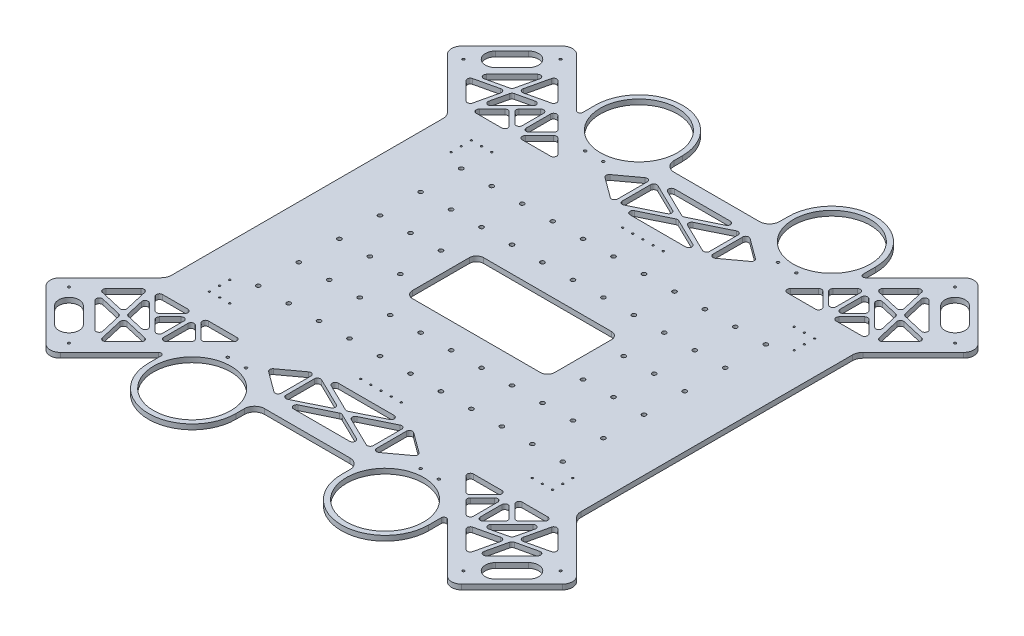
from build123d import *

# Parameters (mm, degrees)
BOSS_EXTRUDE1_DEPTH     = 6.35
CUT_EXTRUDE1_REACH      = 540.853
SKETCH3_R               = 48.260000044
F_4_CLEARANCE_HOLE2_D   = 2.9464
MIRROR2_COPY_1_REACH    = 540.853
MIRROR2_COPY_1_SKETCH_R = 48.260000044
MIRROR2_COPY_2_D        = 2.9464
F_4_CLEARANCE_HOLE1_D   = 3.2639
CUT_EXTRUDE10_DEPTH     = 468.199873044
MIRROR4_COPY_1_D        = 3.2639
MIRROR4_COPY_2_DEPTH    = 468.199873044
F_4_40_TAPPED_HOLE1_D   = 2.2606
CUT_EXTRUDE3_REACH      = 469.2
SKETCH5_W               = 177.8
SKETCH5_H               = 88.9
FILLET1_R               = 8.89
FILLET5_R               = 3.175
FILLET6_R               = 12.7
CUT_EXTRUDE11_DEPTH     = 468.199873044
BOSS_EXTRUDE2_DEPTH     = 6.35
FILLET7_R               = 3.81
FILLET7_OF_MIRROR5_R    = 3.81
MIRROR6_START           = -6.35
MIRROR6_DEPTH           = 6.35
F_1_4_20_TAPPED_HOLE2_D = 5.1054
LPATTERN10_COUNT        = 6
LPATTERN10_PITCH        = 50.8
LPATTERN10_COUNT_DIR2   = 11
LPATTERN10_PITCH_DIR2   = 38.1


# Read off the part's stored shape, not the designer's step: Mirror6
with BuildPart() as part:
    # Sketch1 → Boss-Extrude1 (new body)
    with BuildSketch(Plane(origin=(0, 0, 0), x_dir=(1, 0, 0), z_dir=(0, 1, 0))):
        Polygon((254, -381), (-254, -381), (-381, -254), (-381, 254), (-254, 381), (254, 381), (381, 254), (381, -254), align=None)
    extrude(amount=-BOSS_EXTRUDE1_DEPTH)

    # Sketch3 → Cut-Extrude1 (cut, up to next)
    with BuildSketch(Plane(origin=(0, 0, 0), x_dir=(1, 0, 0), z_dir=(0, 1, 0)), mode=Mode.PRIVATE) as cut_extrude1_sk1:
        with BuildLine():
            Line((-175.260000044, -256.082305134), (-242.065848583, -322.888153673))
            ThreePointArc((-242.065848583, -322.888153673), (-251.046104704, -326.607897552), (-260.026360825, -322.888153673))
            Line((-260.026360825, -322.888153673), (-322.888153673, -260.026360825))
            ThreePointArc((-322.888153673, -260.026360825), (-326.607897552, -251.046104704), (-322.888153673, -242.065848583))
            Line((-322.888153673, -242.065848583), (-256.082305134, -175.260000044))
            Line((-256.082305134, -175.260000044), (-256.082305134, 0))
            Line((-256.082305134, 0), (-381, 0))
            Line((-381, 0), (-381, -254))
            Line((-381, -254), (-254, -381))
            Line((-254, -381), (0, -381))
            Line((0, -381), (0, -256.082305134))
            Line((0, -256.082305134), (-66.039999956, -256.082305134))
            Line((-66.039999956, -256.082305134), (-66.039999956, -279.4))
            ThreePointArc((-66.039999956, -279.4), (-120.65, -334.010000044), (-175.260000044, -279.4))
            Line((-175.260000044, -279.4), (-175.260000044, -256.082305134))
        make_face()
    cut_extrude1_tool1 = extrude(cut_extrude1_sk1.sketch, amount=-CUT_EXTRUDE1_REACH, mode=Mode.PRIVATE) & part.part
    # Sketch3 → Cut-Extrude1 (cut, up to next)
    with BuildSketch(Plane(origin=(0, 0, 0), x_dir=(1, 0, 0), z_dir=(0, 1, 0)), mode=Mode.PRIVATE) as cut_extrude1_sk2:
        with Locations(Location((-120.65, -279.4, 0), (0, 0, 270))):
            Circle(SKETCH3_R)
    cut_extrude1_tool2 = extrude(cut_extrude1_sk2.sketch, amount=-CUT_EXTRUDE1_REACH, mode=Mode.PRIVATE) & part.part
    cut_extrude1_1 = cut_extrude1_tool1.solids().sort_by_distance((-180.648154, 0, 267.741153))[0]
    add(cut_extrude1_1, mode=Mode.SUBTRACT)
    cut_extrude1_2 = cut_extrude1_tool2.solids().sort_by_distance((-120.65, 0, 279.4))[0]
    add(cut_extrude1_2, mode=Mode.SUBTRACT)
    cut_extrude1 = cut_extrude1_1 + cut_extrude1_2  # Cut-Extrude1 as one shape, for the pattern or mirror that repeats it

    # #4 Clearance Hole2 (through all)
    with Locations(Plane(origin=(0, 0, 0), x_dir=(1, 0, 0), z_dir=(0, 1, 0))):
        with Locations((-307.481994282, -246.695700628), (-246.695700628, -307.481994282)):
            f_4_clearance_hole2 = Hole(F_4_CLEARANCE_HOLE2_D / 2)

    # Mirror1: Cut-Extrude1, #4 Clearance Hole2 across plane
    add(cut_extrude1.mirror(Plane(origin=(0, 0, 0), x_dir=(0, 0, 1), z_dir=(1, 0, 0))), mode=Mode.SUBTRACT)
    add(f_4_clearance_hole2.mirror(Plane(origin=(0, 0, 0), x_dir=(0, 0, 1), z_dir=(1, 0, 0))), mode=Mode.SUBTRACT)

    # Mirror2: Cut-Extrude1, #4 Clearance Hole2 across plane
    add(cut_extrude1.mirror(Plane.XY), mode=Mode.SUBTRACT)
    add(f_4_clearance_hole2.mirror(Plane.XY), mode=Mode.SUBTRACT)

    # Mirror2 copy 1 sketch → Mirror2 copy 1 (cut, up to next)
    with BuildSketch(Plane(origin=(0, 0, 0), x_dir=(-1, 0, 0), z_dir=(0, 1, 0)), mode=Mode.PRIVATE) as mirror2_copy_1_sk1:
        with BuildLine():
            Line((-175.260000044, -256.082305134), (-242.065848583, -322.888153673))
            ThreePointArc((-242.065848583, -322.888153673), (-251.046104704, -326.607897552), (-260.026360825, -322.888153673))
            Line((-260.026360825, -322.888153673), (-322.888153673, -260.026360825))
            ThreePointArc((-322.888153673, -260.026360825), (-326.607897552, -251.046104704), (-322.888153673, -242.065848583))
            Line((-322.888153673, -242.065848583), (-256.082305134, -175.260000044))
            Line((-256.082305134, -175.260000044), (-256.082305134, 0))
            Line((-256.082305134, 0), (-381, 0))
            Line((-381, 0), (-381, -254))
            Line((-381, -254), (-254, -381))
            Line((-254, -381), (0, -381))
            Line((0, -381), (0, -256.082305134))
            Line((0, -256.082305134), (-66.039999956, -256.082305134))
            Line((-66.039999956, -256.082305134), (-66.039999956, -279.4))
            ThreePointArc((-66.039999956, -279.4), (-120.65, -334.010000044), (-175.260000044, -279.4))
            Line((-175.260000044, -279.4), (-175.260000044, -256.082305134))
        make_face()
    mirror2_copy_1_tool1 = extrude(mirror2_copy_1_sk1.sketch, amount=-MIRROR2_COPY_1_REACH, mode=Mode.PRIVATE) & part.part
    # Mirror2 copy 1 sketch → Mirror2 copy 1 (cut, up to next)
    with BuildSketch(Plane(origin=(0, 0, 0), x_dir=(-1, 0, 0), z_dir=(0, 1, 0)), mode=Mode.PRIVATE) as mirror2_copy_1_sk2:
        with Locations(Location((-120.65, -279.4, 0), (0, 0, 270))):
            Circle(MIRROR2_COPY_1_SKETCH_R)
    mirror2_copy_1_tool2 = extrude(mirror2_copy_1_sk2.sketch, amount=-MIRROR2_COPY_1_REACH, mode=Mode.PRIVATE) & part.part
    add(mirror2_copy_1_tool1.solids().sort_by_distance((180.648154, 0, -267.741153))[0], mode=Mode.SUBTRACT)
    add(mirror2_copy_1_tool2.solids().sort_by_distance((120.65, 0, -279.4))[0], mode=Mode.SUBTRACT)

    # Mirror2 copy 2 (through all)
    with Locations(Plane(origin=(0, 0, 0), x_dir=(-1, 0, 0), z_dir=(0, 1, 0))):
        with Locations((-307.481994282, -246.695700628), (-246.695700628, -307.481994282)):
            Hole(MIRROR2_COPY_2_D / 2)

    # #4 Clearance Hole1 (through all)
    with Locations(Plane(origin=(0, 0, 0), x_dir=(1, 0, 0), z_dir=(0, 1, 0))):
        with Locations((109.22, -223.520030004), (132.08, -223.520030004)):
            f_4_clearance_hole1 = Hole(F_4_CLEARANCE_HOLE1_D / 2)

    # Sketch13 → Cut-Extrude10 (cut, through all)
    with BuildSketch(Plane.XZ.offset(6.35)):
        with BuildLine():
            Line((-278.377893355, -257.839289313), (-257.839289313, -278.377893355))
            ThreePointArc((-257.839289313, -278.377893355), (-257.839289313, -296.338405597), (-275.799801555, -296.338405597))
            Line((-275.799801555, -296.338405597), (-296.338405597, -275.799801555))
            ThreePointArc((-296.338405597, -275.799801555), (-296.338405597, -257.839289313), (-278.377893355, -257.839289313))
        make_face()
    cut_extrude10 = extrude(amount=-CUT_EXTRUDE10_DEPTH, mode=Mode.SUBTRACT)

    # Mirror3: #4 Clearance Hole1, Cut-Extrude10 across plane
    add(f_4_clearance_hole1.mirror(Plane(origin=(0, 0, 0), x_dir=(0, 0, 1), z_dir=(1, 0, 0))), mode=Mode.SUBTRACT)
    add(cut_extrude10.mirror(Plane(origin=(0, 0, 0), x_dir=(0, 0, 1), z_dir=(1, 0, 0))), mode=Mode.SUBTRACT)

    # Mirror4: #4 Clearance Hole1, Cut-Extrude10 across plane
    add(f_4_clearance_hole1.mirror(Plane.XY), mode=Mode.SUBTRACT)
    add(cut_extrude10.mirror(Plane.XY), mode=Mode.SUBTRACT)

    # Mirror4 copy 1 (through all)
    with Locations(Plane(origin=(0, 0, 0), x_dir=(-1, 0, 0), z_dir=(0, 1, 0))):
        with Locations((109.22, -223.520030004), (132.08, -223.520030004)):
            Hole(MIRROR4_COPY_1_D / 2)

    # Mirror4 copy 2 sketch → Mirror4 copy 2 (cut, through all)
    with BuildSketch(Plane(origin=(0, -6.35, 0), x_dir=(-1, 0, 0), z_dir=(0, -1, 0))):
        with BuildLine():
            Line((-278.377893355, -257.839289313), (-257.839289313, -278.377893355))
            ThreePointArc((-257.839289313, -278.377893355), (-257.839289313, -296.338405597), (-275.799801555, -296.338405597))
            Line((-275.799801555, -296.338405597), (-296.338405597, -275.799801555))
            ThreePointArc((-296.338405597, -275.799801555), (-296.338405597, -257.839289313), (-278.377893355, -257.839289313))
        make_face()
    extrude(amount=-MIRROR4_COPY_2_DEPTH, mode=Mode.SUBTRACT)

    # #4-40 Tapped Hole1 (through all)
    with Locations(Plane(origin=(0, -6.35, 0), x_dir=(-1, 0, 0), z_dir=(0, -1, 0))):
        with Locations((189.23, -163.83), (201.93, -163.83), (214.63, -163.83), (214.63, -151.13), (214.63, -138.43), (25.4, -163.83), (12.7, -163.83), (0, -163.83), (-12.7, -163.83), (-25.4, -163.83), (-189.23, -163.83), (-201.93, -163.83), (-214.63, -163.83), (-214.63, -151.13), (-214.63, -138.43), (214.63, 138.43), (214.63, 151.13), (214.63, 163.83), (201.93, 163.83), (189.23, 163.83), (25.4, 163.83), (12.7, 163.83), (0, 163.83), (-12.7, 163.83), (-25.4, 163.83), (-214.63, 163.83), (-214.63, 151.13), (-214.63, 138.43), (-201.93, 163.83), (-189.23, 163.83)):
            Hole(F_4_40_TAPPED_HOLE1_D / 2)

    # Sketch5 → Cut-Extrude3 (cut, up to next)
    with BuildSketch(Plane(origin=(0, 0, 0), x_dir=(1, 0, 0), z_dir=(0, 1, 0)), mode=Mode.PRIVATE) as cut_extrude3_sk1:
        Rectangle(SKETCH5_W, SKETCH5_H)
    cut_extrude3_tool1 = extrude(cut_extrude3_sk1.sketch, amount=-CUT_EXTRUDE3_REACH, mode=Mode.PRIVATE) & part.part
    add(cut_extrude3_tool1.solids().sort_by_distance((0, 0, 0))[0], mode=Mode.SUBTRACT)

    # Fillet1
    fillet1_edges = [part.edges().sort_by_distance(p)[0] for p in [
        (88.9, -3.175, -44.45),
        (88.9, -3.175, 44.45),
        (-88.9, -3.175, 44.45),
        (-88.9, -3.175, -44.45),
    ]]
    fillet(fillet1_edges, radius=FILLET1_R)

    # Fillet5
    fillet5_edges = [part.edges().sort_by_distance(p)[0] for p in [
        (175.260000044, -3.175, -256.082305134),
        (-175.260000044, -3.175, -256.082305134),
        (-175.260000044, -3.175, 256.082305134),
        (175.260000044, -3.175, 256.082305134),
    ]]
    fillet(fillet5_edges, radius=FILLET5_R)

    # Fillet6
    fillet6_edges = [part.edges().sort_by_distance(p)[0] for p in [
        (66.039999956, -3.175, 256.082305134),
        (66.039999956, -3.175, -256.082305134),
        (256.082305134, -3.175, -175.260000044),
        (-256.082305134, -3.175, -175.260000044),
        (-66.039999956, -3.175, -256.082305134),
        (-66.039999956, -3.175, 256.082305134),
        (-256.082305134, -3.175, 175.260000044),
        (256.082305134, -3.175, 175.260000044),
    ]]
    fillet(fillet6_edges, radius=FILLET6_R)

    # Sketch22 → Cut-Extrude11 (cut, through all)
    with BuildSketch(Plane.XZ.offset(6.35)):
        Polygon((-57.15, 182.422305134), (57.15, 182.422305134), (95.25, 210.362305134), (57.15, 238.302305134), (-57.15, 238.302305134), (-95.25, 210.362305134), align=None)
        Polygon((196.266542366, 253.74018154), (232.18756685, 289.661206025), (289.661206025, 232.18756685), (253.74018154, 196.266542366), (196.266542366, 196.266542366), (138.792903191, 196.266542366), align=None)
    cut_extrude11 = extrude(amount=-CUT_EXTRUDE11_DEPTH, mode=Mode.SUBTRACT)

    # Sketch23 → Boss-Extrude2 (add)
    # profile 1 of 2: a face of its own
    with BuildSketch(Plane.XZ.offset(6.35)):
        Polygon((-59.69, 242.37138057), (-59.69, 178.353229697), (0, 207.535007475), (59.69, 178.353229697), (59.69, 242.37138057), (0, 213.189602792), align=None)
        Polygon((-54.61, 186.49138057), (-5.783108847, 210.362305134), (-54.61, 234.233229697), align=None, mode=Mode.SUBTRACT)
        Polygon((54.61, 186.49138057), (5.783108847, 210.362305134), (54.61, 234.233229697), align=None, mode=Mode.SUBTRACT)
    # profile 2 of 2: a face of its own
    with BuildSketch(Plane.XZ.offset(6.35)):
        Polygon((196.266542366, 192.674439917), (225.003361953, 221.411259505), (258.206594947, 188.20802651), (246.352656867, 239.575091523), (289.090062878, 229.712613213), (290.232349172, 234.662520487), (245.081863365, 245.081863365), (234.662520487, 290.232349172), (229.712613213, 289.090062878), (239.575091523, 246.352656867), (188.20802651, 258.206594947), (193.726542366, 252.688079092), (193.726542366, 202.398644814), (169.325774002, 226.799413177), (165.733671554, 223.207310729), align=None)
        Polygon((249.273768134, 204.325058221), (204.325058221, 249.273768134), (240.845885025, 240.845885025), align=None, mode=Mode.SUBTRACT)
        Polygon((221.411259505, 225.003361953), (198.806542366, 247.608079092), (198.806542366, 202.398644814), align=None, mode=Mode.SUBTRACT)
    boss_extrude2 = extrude(amount=-BOSS_EXTRUDE2_DEPTH)

    # Fillet7
    fillet7_edges = [part.edges().sort_by_distance(p)[0] for p in [
        (95.25, -3.175, 210.362305134),
        (-95.25, -3.175, 210.362305134),
        (138.792903191, -3.175, 196.266542366),
        (51.366891153, -3.175, 238.302305134),
        (-51.366891153, -3.175, 238.302305134),
        (-59.69, -3.175, 236.439638467),
        (-51.366891153, -3.175, 182.422305134),
        (51.366891153, -3.175, 182.422305134),
        (59.69, -3.175, 184.2849718),
        (59.69, -3.175, 236.439638467),
        (0, -3.175, 207.535007475),
        (-59.69, -3.175, 184.2849718),
        (0, -3.175, 213.189602792),
        (54.61, -3.175, 186.49138057),
        (5.783108847, -3.175, 210.362305134),
        (54.61, -3.175, 234.233229697),
        (-5.783108847, -3.175, 210.362305134),
        (-54.61, -3.175, 186.49138057),
        (-54.61, -3.175, 234.233229697),
        (192.674439917, -3.175, 196.266542366),
        (199.858644814, -3.175, 196.266542366),
        (250.148079092, -3.175, 196.266542366),
        (255.858170711, -3.175, 198.384531536),
        (287.543216855, -3.175, 230.06957768),
        (286.272423352, -3.175, 235.576349522),
        (235.576349522, -3.175, 286.272423352),
        (230.06957768, -3.175, 287.543216855),
        (198.384531536, -3.175, 255.858170711),
        (193.726542366, -3.175, 251.20018154),
        (193.726542366, -3.175, 202.398644814),
        (239.575091523, -3.175, 246.352656867),
        (245.081863365, -3.175, 245.081863365),
        (246.352656867, -3.175, 239.575091523),
        (225.003361953, -3.175, 221.411259505),
        (165.733671554, -3.175, 223.207310729),
        (169.325774002, -3.175, 226.799413177),
        (249.273768134, -3.175, 204.325058221),
        (204.325058221, -3.175, 249.273768134),
        (240.845885025, -3.175, 240.845885025),
        (198.806542366, -3.175, 202.398644814),
        (198.806542366, -3.175, 247.608079092),
        (221.411259505, -3.175, 225.003361953),
    ]]
    fillet(fillet7_edges, radius=FILLET7_R)

    # Mirror5: Cut-Extrude11, Boss-Extrude2 across plane
    add(cut_extrude11.mirror(Plane(origin=(0, 0, 0), x_dir=(0, 0, 1), z_dir=(1, 0, 0))), mode=Mode.SUBTRACT)
    add(boss_extrude2.mirror(Plane(origin=(0, 0, 0), x_dir=(0, 0, 1), z_dir=(1, 0, 0))))

    # Fillet7 of Mirror5
    fillet7_of_mirror5_edges = [part.edges().sort_by_distance(p)[0] for p in [
        (-95.25, -3.175, 210.362305134),
        (95.25, -3.175, 210.362305134),
        (-138.792903191, -3.175, 196.266542366),
        (-51.366891153, -3.175, 238.302305134),
        (51.366891153, -3.175, 238.302305134),
        (59.69, -3.175, 236.439638467),
        (51.366891153, -3.175, 182.422305134),
        (-51.366891153, -3.175, 182.422305134),
        (-59.69, -3.175, 184.2849718),
        (-59.69, -3.175, 236.439638467),
        (0, -3.175, 207.535007475),
        (59.69, -3.175, 184.2849718),
        (0, -3.175, 213.189602792),
        (-54.61, -3.175, 186.49138057),
        (-5.783108847, -3.175, 210.362305134),
        (-54.61, -3.175, 234.233229697),
        (5.783108847, -3.175, 210.362305134),
        (54.61, -3.175, 186.49138057),
        (54.61, -3.175, 234.233229697),
        (-192.674439917, -3.175, 196.266542366),
        (-199.858644814, -3.175, 196.266542366),
        (-250.148079092, -3.175, 196.266542366),
        (-255.858170711, -3.175, 198.384531536),
        (-287.543216855, -3.175, 230.06957768),
        (-286.272423352, -3.175, 235.576349522),
        (-235.576349522, -3.175, 286.272423352),
        (-230.06957768, -3.175, 287.543216855),
        (-198.384531536, -3.175, 255.858170711),
        (-193.726542366, -3.175, 251.20018154),
        (-193.726542366, -3.175, 202.398644814),
        (-239.575091523, -3.175, 246.352656867),
        (-245.081863365, -3.175, 245.081863365),
        (-246.352656867, -3.175, 239.575091523),
        (-225.003361953, -3.175, 221.411259505),
        (-165.733671554, -3.175, 223.207310729),
        (-169.325774002, -3.175, 226.799413177),
        (-249.273768134, -3.175, 204.325058221),
        (-204.325058221, -3.175, 249.273768134),
        (-240.845885025, -3.175, 240.845885025),
        (-198.806542366, -3.175, 202.398644814),
        (-198.806542366, -3.175, 247.608079092),
        (-221.411259505, -3.175, 225.003361953),
    ]]
    fillet(fillet7_of_mirror5_edges, radius=FILLET7_OF_MIRROR5_R)

    # Mirror6 outline → Mirror6 (cut)
    with BuildSketch(Plane(origin=(0, 0, 0), x_dir=(1, 0, 0), z_dir=(0, 1, 0)).offset(MIRROR6_START)):
        with BuildLine():
            Line((209.056798487, 196.266542366), (240.949925419, 196.266542366))
            ThreePointArc((240.949925419, 196.266542366), (244.469906438, 198.618518488), (243.644002256, 202.770619202))
            Line((243.644002256, 202.770619202), (227.697438789, 218.717182668))
            ThreePointArc((227.697438789, 218.717182668), (225.003361953, 219.833105832), (222.309285117, 218.717182668))
            Line((222.309285117, 218.717182668), (206.36272165, 202.770619202))
            ThreePointArc((206.36272165, 202.770619202), (205.536817468, 198.618518488), (209.056798487, 196.266542366))
        make_face()
        with BuildLine():
            Line((147.991056863, 196.266542366), (183.476286244, 196.266542366))
            ThreePointArc((183.476286244, 196.266542366), (186.996267263, 198.618518488), (186.170363081, 202.770619202))
            Line((186.170363081, 202.770619202), (168.42774839, 220.513233892))
            ThreePointArc((168.42774839, 220.513233892), (165.733671554, 221.629157056), (163.039594718, 220.513233892))
            Line((163.039594718, 220.513233892), (145.296980027, 202.770619202))
            ThreePointArc((145.296980027, 202.770619202), (144.471075844, 198.618518488), (147.991056863, 196.266542366))
        make_face()
        with BuildLine():
            ThreePointArc((-243.644002256, 202.770619202), (-244.469906438, 198.618518488), (-240.949925419, 196.266542366))
            Line((-240.949925419, 196.266542366), (-209.056798487, 196.266542366))
            ThreePointArc((-209.056798487, 196.266542366), (-205.536817468, 198.618518488), (-206.36272165, 202.770619202))
            Line((-206.36272165, 202.770619202), (-222.309285117, 218.717182668))
            ThreePointArc((-222.309285117, 218.717182668), (-225.003361953, 219.833105832), (-227.697438789, 218.717182668))
            Line((-227.697438789, 218.717182668), (-243.644002256, 202.770619202))
        make_face()
        with BuildLine():
            ThreePointArc((-186.170363081, 202.770619202), (-186.996267263, 198.618518488), (-183.476286244, 196.266542366))
            Line((-183.476286244, 196.266542366), (-147.991056863, 196.266542366))
            ThreePointArc((-147.991056863, 196.266542366), (-144.471075844, 198.618518488), (-145.296980027, 202.770619202))
            Line((-145.296980027, 202.770619202), (-163.039594718, 220.513233892))
            ThreePointArc((-163.039594718, 220.513233892), (-165.733671554, 221.629157056), (-168.42774839, 220.513233892))
            Line((-168.42774839, 220.513233892), (-186.170363081, 202.770619202))
        make_face()
        with BuildLine():
            Line((260.718952489, 203.245313314), (282.682435077, 225.208795902))
            ThreePointArc((282.682435077, 225.208795902), (283.650715963, 228.953223113), (280.845072961, 231.615303194))
            Line((280.845072961, 231.615303194), (252.292545596, 238.20434797))
            ThreePointArc((252.292545596, 238.20434797), (248.741754039, 237.185994351), (247.72340042, 233.635202794))
            Line((247.72340042, 233.635202794), (254.312445197, 205.08267543))
            ThreePointArc((254.312445197, 205.08267543), (256.974525278, 202.277032427), (260.718952489, 203.245313314))
        make_face()
        with BuildLine():
            Line((276.878726406, 244.970046469), (244.970046469, 276.878726406))
            ThreePointArc((244.970046469, 276.878726406), (240.429001524, 277.517037423), (238.563539177, 273.327934849))
            Line((238.563539177, 273.327934849), (244.546416665, 247.4021324))
            ThreePointArc((244.546416665, 247.4021324), (245.564770284, 245.564770284), (247.4021324, 244.546416665))
            Line((247.4021324, 244.546416665), (273.327934849, 238.563539177))
            ThreePointArc((273.327934849, 238.563539177), (277.517037423, 240.429001524), (276.878726406, 244.970046469))
        make_face()
        with BuildLine():
            Line((187.222465529, 244.696104704), (172.019850839, 229.493490014))
            ThreePointArc((172.019850839, 229.493490014), (170.903927675, 226.799413178), (172.019850839, 224.105336341))
            Line((172.019850839, 224.105336341), (187.222465529, 208.90272165))
            ThreePointArc((187.222465529, 208.90272165), (191.374566243, 208.076817468), (193.726542366, 211.596798487))
            Line((193.726542366, 211.596798487), (193.726542366, 242.002027868))
            ThreePointArc((193.726542366, 242.002027868), (191.374566243, 245.522008887), (187.222465529, 244.696104704))
        make_face()
        with BuildLine():
            Line((225.208795902, 282.682435077), (203.245313314, 260.718952489))
            ThreePointArc((203.245313314, 260.718952489), (202.277032427, 256.974525278), (205.08267543, 254.312445197))
            Line((205.08267543, 254.312445197), (233.635202794, 247.72340042))
            ThreePointArc((233.635202794, 247.72340042), (237.185994351, 248.741754039), (238.20434797, 252.292545596))
            Line((238.20434797, 252.292545596), (231.615303194, 280.845072961))
            ThreePointArc((231.615303194, 280.845072961), (228.953223113, 283.650715963), (225.208795902, 282.682435077))
        make_face()
        with BuildLine():
            ThreePointArc((-59.69, 228.920965357), (-61.777820288, 232.319523439), (-65.753095558, 231.993368391))
            Line((-65.753095558, 231.993368391), (-91.060359499, 213.434708168))
            ThreePointArc((-91.060359499, 213.434708168), (-92.61726394, 210.362305134), (-91.060359499, 207.289902099))
            Line((-91.060359499, 207.289902099), (-65.753095558, 188.731241876))
            ThreePointArc((-65.753095558, 188.731241876), (-61.777820287, 188.405086828), (-59.69, 191.803644911))
            Line((-59.69, 191.803644911), (-59.69, 228.920965357))
        make_face()
        with BuildLine():
            ThreePointArc((-36.572436668, 189.655149549), (-38.6109955, 185.373508657), (-34.899046065, 182.422305134))
            Line((-34.899046065, 182.422305134), (34.899046065, 182.422305134))
            ThreePointArc((34.899046065, 182.422305134), (38.6109955, 185.373508657), (36.572436668, 189.655149549))
            Line((36.572436668, 189.655149549), (1.673390603, 206.716905403))
            ThreePointArc((1.673390603, 206.716905403), (0, 207.104060988), (-1.673390603, 206.716905403))
            Line((-1.673390603, 206.716905403), (-36.572436668, 189.655149549))
        make_face()
        with BuildLine():
            ThreePointArc((59.69, 191.803644911), (61.777820287, 188.405086828), (65.753095558, 188.731241876))
            Line((65.753095558, 188.731241876), (91.060359499, 207.289902099))
            ThreePointArc((91.060359499, 207.289902099), (92.61726394, 210.362305134), (91.060359499, 213.434708168))
            Line((91.060359499, 213.434708168), (65.753095558, 231.993368391))
            ThreePointArc((65.753095558, 231.993368391), (61.777820288, 232.319523439), (59.69, 228.920965357))
            Line((59.69, 228.920965357), (59.69, 191.803644911))
        make_face()
        with BuildLine():
            ThreePointArc((36.572436668, 231.069460719), (38.6109955, 235.351101611), (34.899046065, 238.302305134))
            Line((34.899046065, 238.302305134), (-34.899046065, 238.302305134))
            ThreePointArc((-34.899046065, 238.302305134), (-38.6109955, 235.351101611), (-36.572436668, 231.069460719))
            Line((-36.572436668, 231.069460719), (-1.673390603, 214.007704865))
            ThreePointArc((-1.673390603, 214.007704865), (0, 213.62054928), (1.673390603, 214.007704865))
            Line((1.673390603, 214.007704865), (36.572436668, 231.069460719))
        make_face()
        with BuildLine():
            ThreePointArc((-172.019850839, 224.105336341), (-170.903927675, 226.799413178), (-172.019850839, 229.493490014))
            Line((-172.019850839, 229.493490014), (-187.222465529, 244.696104704))
            ThreePointArc((-187.222465529, 244.696104704), (-191.374566243, 245.522008887), (-193.726542366, 242.002027868))
            Line((-193.726542366, 242.002027868), (-193.726542366, 211.596798487))
            ThreePointArc((-193.726542366, 211.596798487), (-191.374566243, 208.076817468), (-187.222465529, 208.90272165))
            Line((-187.222465529, 208.90272165), (-172.019850839, 224.105336341))
        make_face()
        with BuildLine():
            ThreePointArc((-205.08267543, 254.312445197), (-202.277032427, 256.974525278), (-203.245313314, 260.718952489))
            Line((-203.245313314, 260.718952489), (-225.208795902, 282.682435077))
            ThreePointArc((-225.208795902, 282.682435077), (-228.953223113, 283.650715963), (-231.615303194, 280.845072961))
            Line((-231.615303194, 280.845072961), (-238.20434797, 252.292545596))
            ThreePointArc((-238.20434797, 252.292545596), (-237.185994351, 248.741754039), (-233.635202794, 247.72340042))
            Line((-233.635202794, 247.72340042), (-205.08267543, 254.312445197))
        make_face()
        with BuildLine():
            ThreePointArc((-280.845072961, 231.615303194), (-283.650715963, 228.953223113), (-282.682435077, 225.208795902))
            Line((-282.682435077, 225.208795902), (-260.718952489, 203.245313314))
            ThreePointArc((-260.718952489, 203.245313314), (-256.974525278, 202.277032427), (-254.312445197, 205.08267543))
            Line((-254.312445197, 205.08267543), (-247.72340042, 233.635202794))
            ThreePointArc((-247.72340042, 233.635202794), (-248.741754039, 237.185994351), (-252.292545596, 238.20434797))
            Line((-252.292545596, 238.20434797), (-280.845072961, 231.615303194))
        make_face()
        with BuildLine():
            ThreePointArc((-218.717182668, 227.697438789), (-219.833105832, 225.003361953), (-218.717182668, 222.309285117))
            Line((-218.717182668, 222.309285117), (-205.310619202, 208.90272165))
            ThreePointArc((-205.310619202, 208.90272165), (-201.158518488, 208.076817468), (-198.806542366, 211.596798487))
            Line((-198.806542366, 211.596798487), (-198.806542366, 238.409925419))
            ThreePointArc((-198.806542366, 238.409925419), (-201.158518488, 241.929906438), (-205.310619202, 241.104002256))
            Line((-205.310619202, 241.104002256), (-218.717182668, 227.697438789))
        make_face()
        with BuildLine():
            Line((198.806542366, 238.409925419), (198.806542366, 211.596798487))
            ThreePointArc((198.806542366, 211.596798487), (201.158518488, 208.076817468), (205.310619202, 208.90272165))
            Line((205.310619202, 208.90272165), (218.717182668, 222.309285117))
            ThreePointArc((218.717182668, 222.309285117), (219.833105832, 225.003361953), (218.717182668, 227.697438789))
            Line((218.717182668, 227.697438789), (205.310619202, 241.104002256))
            ThreePointArc((205.310619202, 241.104002256), (201.158518488, 241.929906438), (198.806542366, 238.409925419))
        make_face()
        with BuildLine():
            Line((-54.61, 228.129616543), (-54.61, 192.594993724))
            ThreePointArc((-54.61, 192.594993724), (-52.817483804, 189.362988294), (-49.126609397, 189.172149309))
            Line((-49.126609397, 189.172149309), (-12.784381514, 206.939460719))
            ThreePointArc((-12.784381514, 206.939460719), (-10.647772117, 210.362305134), (-12.784381514, 213.785149549))
            Line((-12.784381514, 213.785149549), (-49.126609397, 231.552460958))
            ThreePointArc((-49.126609397, 231.552460958), (-52.817483804, 231.361621973), (-54.61, 228.129616543))
        make_face()
        with BuildLine():
            Line((54.61, 192.594993724), (54.61, 228.129616543))
            ThreePointArc((54.61, 228.129616543), (52.817483804, 231.361621973), (49.126609397, 231.552460958))
            Line((49.126609397, 231.552460958), (12.784381514, 213.785149549))
            ThreePointArc((12.784381514, 213.785149549), (10.647772117, 210.362305134), (12.784381514, 206.939460719))
            Line((12.784381514, 206.939460719), (49.126609397, 189.172149309))
            ThreePointArc((49.126609397, 189.172149309), (52.817483804, 189.362988294), (54.61, 192.594993724))
        make_face()
        with BuildLine():
            ThreePointArc((-238.563539177, 273.327934849), (-240.429001524, 277.517037423), (-244.970046469, 276.878726406))
            Line((-244.970046469, 276.878726406), (-276.878726406, 244.970046469))
            ThreePointArc((-276.878726406, 244.970046469), (-277.517037423, 240.429001524), (-273.327934849, 238.563539177))
            Line((-273.327934849, 238.563539177), (-247.4021324, 244.546416665))
            ThreePointArc((-247.4021324, 244.546416665), (-245.564770284, 245.564770284), (-244.546416665, 247.4021324))
            Line((-244.546416665, 247.4021324), (-238.563539177, 273.327934849))
        make_face()
        with BuildLine():
            ThreePointArc((-238.52561599, 241.381331725), (-240.362978106, 240.362978106), (-241.381331725, 238.52561599))
            Line((-241.381331725, 238.52561599), (-246.286578479, 217.269546724))
            ThreePointArc((-246.286578479, 217.269546724), (-244.421116132, 213.08044415), (-239.880071187, 213.718755167))
            Line((-239.880071187, 213.718755167), (-213.718755167, 239.880071187))
            ThreePointArc((-213.718755167, 239.880071187), (-213.08044415, 244.421116132), (-217.269546724, 246.286578479))
            Line((-217.269546724, 246.286578479), (-238.52561599, 241.381331725))
        make_face()
        with BuildLine():
            Line((238.52561599, 241.381331725), (217.269546724, 246.286578479))
            ThreePointArc((217.269546724, 246.286578479), (213.08044415, 244.421116132), (213.718755167, 239.880071187))
            Line((213.718755167, 239.880071187), (239.880071187, 213.718755167))
            ThreePointArc((239.880071187, 213.718755167), (244.421116132, 213.08044415), (246.286578479, 217.269546724))
            Line((246.286578479, 217.269546724), (241.381331725, 238.52561599))
            ThreePointArc((241.381331725, 238.52561599), (240.362978106, 240.362978106), (238.52561599, 241.381331725))
        make_face()
    extrude(amount=MIRROR6_DEPTH, mode=Mode.SUBTRACT)

    # 1/4-20 Tapped Hole2 (through all)
    with Locations(Plane(origin=(0, -6.35, 0), x_dir=(-1, 0, 0), z_dir=(0, -1, 0))):
        with Locations((-190.5, 127)):
            f_1_4_20_tapped_hole2 = Hole(F_1_4_20_TAPPED_HOLE2_D / 2)

    # LPattern10: 1_4-20 Tapped Hole2 6 × 11, 10 skipped
    with Locations(*[(-j * LPATTERN10_PITCH_DIR2, 0, i * LPATTERN10_PITCH) for i in range(LPATTERN10_COUNT) for j in range(LPATTERN10_COUNT_DIR2) if (i, j) not in ((0, 0), (2, 3), (2, 4), (2, 5), (2, 6), (2, 7), (3, 3), (3, 4), (3, 5), (3, 6), (3, 7))]):
        add(f_1_4_20_tapped_hole2, mode=Mode.SUBTRACT)


solid = part.part
